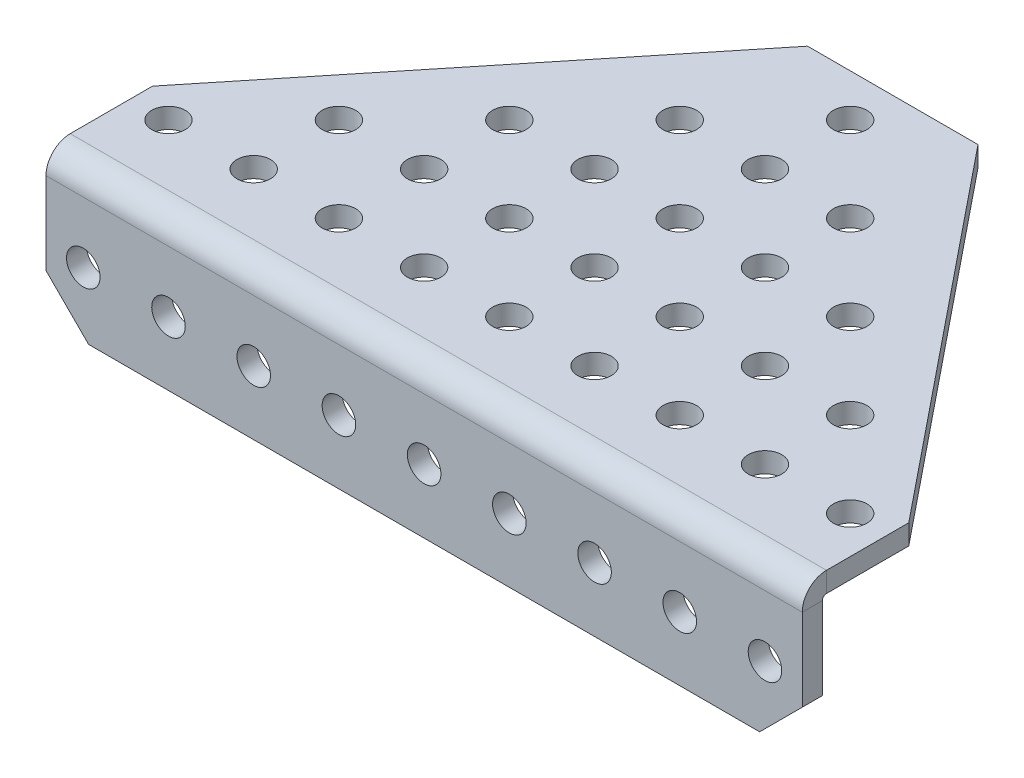
from build123d import *

# Parameters (mm, degrees)
BASE_FLANGE1_DEPTH      = 3
F_10_CLEARANCE_HOLE1_D  = 5
EDGE_FLANGE1_DEPTH      = 112.7125
EDGE_FLANGE1_START      = 3
EDGE_FLANGE1_PROFILE_R  = 2.5
EDGE_FLANGE1_FLAT_DEPTH = 3


# Sheet-metal steps are written as plain solids
with BuildPart() as part:
    # Sketch7 → Base-Flange1 (new body)
    with BuildSketch(Plane(origin=(0, 0, 0), x_dir=(1, 0, 0), z_dir=(0, 1, 0))):
        Polygon((-56.35625, 15.875), (-56.35625, 3.6096), (56.35625, 3.6096), (56.35625, 15.875), (12.7, 69.85), (-12.7, 69.85), align=None)
    extrude(amount=-BASE_FLANGE1_DEPTH)

    # #10 Clearance Hole1 (through all)
    with Locations(Plane(origin=(0, -3, 0), x_dir=(-1, 0, 0), z_dir=(0, -1, 0))):
        with Locations((-50.8, 12.7), (50.8, 12.7), (-38.1, 25.4), (38.1, 25.4), (-25.4, 38.1), (-38.1, 12.7), (-25.4, 12.7), (-25.4, 25.4), (38.1, 12.7), (25.4, 12.7), (25.4, 38.1), (25.4, 25.4), (12.7, 38.1), (12.7, 25.4), (12.7, 12.7), (-12.7, 12.7), (-12.7, 25.4), (-12.7, 38.1), (-12.7, 50.8), (12.7, 50.8), (0, 63.5), (0, 50.8), (0, 38.1), (0, 25.4), (0, 12.7)):
            Hole(F_10_CLEARANCE_HOLE1_D / 2)

    # Edge-Flange1 bend section (across the edge) → Edge-Flange1 (add)
    with BuildSketch(Plane(origin=(56.35625, -3, -3), x_dir=(0, 0, -1), z_dir=(-1, 0, 0))):
        with BuildLine():
            Line((-3, 0.6096), (0, 0.6096))
            ThreePointArc((0, 0.6096), (0.178547706, 0.178547706), (0.6096, 0))
            Line((0.6096, 0), (0.6096, -3))
            ThreePointArc((0.6096, -3), (-1.942772637, -1.942772637), (-3, 0.6096))
        make_face()
    extrude(amount=EDGE_FLANGE1_DEPTH)

    # Edge-Flange1 profile (on flange) → Edge-Flange1 flat (add)
    with BuildSketch(Plane(origin=(0, -3, -3), x_dir=(-1, 0, 0), z_dir=(0, 0, 1)).offset(EDGE_FLANGE1_START)):
        Polygon((-56.35625, 0.6096), (56.35625, 0.6096), (56.35625, 12.875), (50.00625, 19.225), (-50.00625, 19.225), (-56.35625, 12.875), align=None)
        with Locations((50.8, 9.7)):
            Circle(EDGE_FLANGE1_PROFILE_R, mode=Mode.SUBTRACT)
        with Locations((38.1, 9.7)):
            Circle(EDGE_FLANGE1_PROFILE_R, mode=Mode.SUBTRACT)
        with Locations((25.4, 9.7)):
            Circle(EDGE_FLANGE1_PROFILE_R, mode=Mode.SUBTRACT)
        with Locations((12.7, 9.7)):
            Circle(EDGE_FLANGE1_PROFILE_R, mode=Mode.SUBTRACT)
        with Locations((0, 9.7)):
            Circle(EDGE_FLANGE1_PROFILE_R, mode=Mode.SUBTRACT)
        with Locations((-12.7, 9.7)):
            Circle(EDGE_FLANGE1_PROFILE_R, mode=Mode.SUBTRACT)
        with Locations((-25.4, 9.7)):
            Circle(EDGE_FLANGE1_PROFILE_R, mode=Mode.SUBTRACT)
        with Locations((-38.1, 9.7)):
            Circle(EDGE_FLANGE1_PROFILE_R, mode=Mode.SUBTRACT)
        with Locations((-50.8, 9.7)):
            Circle(EDGE_FLANGE1_PROFILE_R, mode=Mode.SUBTRACT)
    extrude(amount=-EDGE_FLANGE1_FLAT_DEPTH)


solid = part.part
